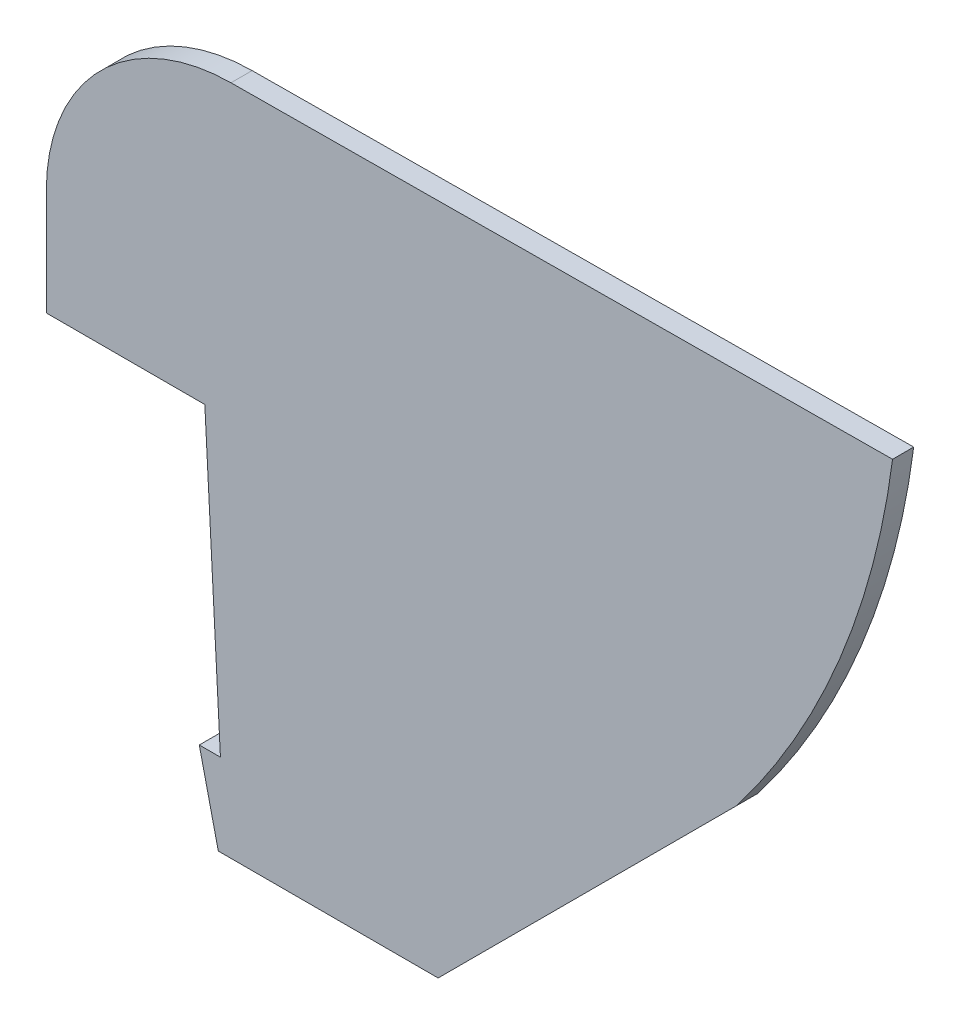
from build123d import *

# Parameters (mm, degrees)
BOSS_EXTRU_1_DEPTH = 5


with BuildPart() as part:
    # Esquisse1 → Boss.-Extru.1 (new body)
    with BuildSketch(Plane.XY):
        with BuildLine():
            Line((0, 0), (0, -25))
            Line((0, -25), (37.5, -25))
            Line((37.5, -25), (41.189684915, -95.4033822))
            Line((41.189684915, -95.4033822), (36.189684915, -95.4033822))
            Line((36.189684915, -95.4033822), (40.688706002, -114.890783496))
            Line((40.688706002, -114.890783496), (92.688706002, -114.890783496))
            Line((92.688706002, -114.890783496), (163.399384121, -44.180105377))
            ThreePointArc((163.399384121, -44.180105377), (187.704789197, -1.962420165), (200.182925478, 45.126663235))
            Line((200.182925478, 45.126663235), (43.682925478, 43.998857528))
            ThreePointArc((43.682925478, 43.998857528), (12.775400091, 31.000392909), (0, 0))
        make_face()
    extrude(amount=BOSS_EXTRU_1_DEPTH)


solid = part.part
